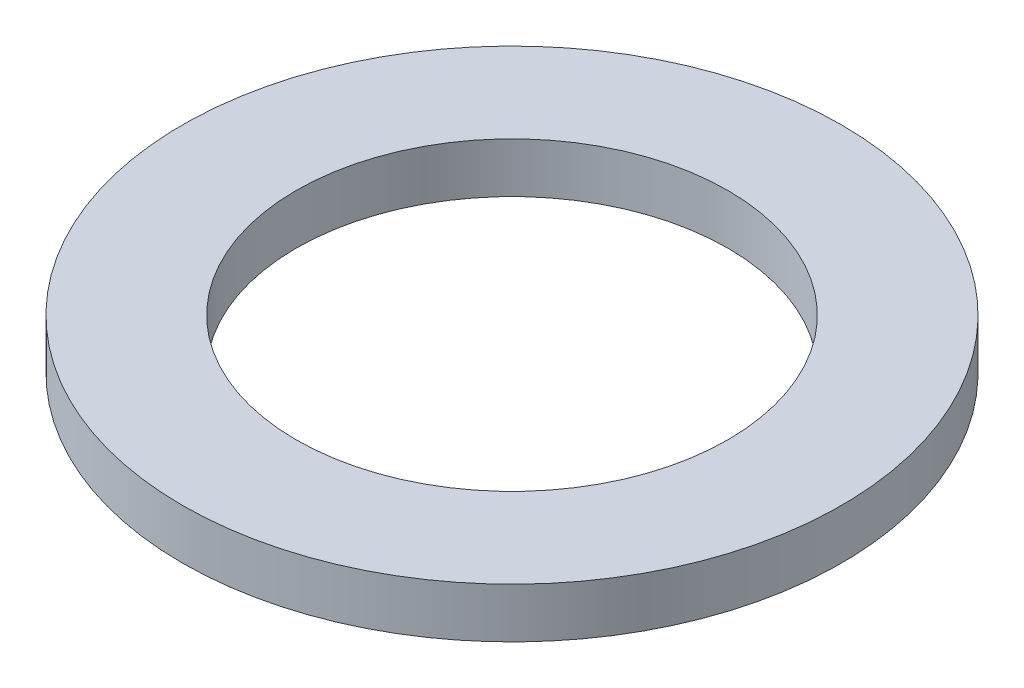
from build123d import *

# Parameters (mm, degrees)
SKETCH1_R           = 72.5
BOSS_EXTRUDE1_DEPTH = 11
SKETCH2_R           = 47.5
CUT_EXTRUDE1_DEPTH  = 104.118863454


with BuildPart() as part:
    # Sketch1 → Boss-Extrude1 (new body)
    with BuildSketch(Plane(origin=(0, 0, 0), x_dir=(1, 0, 0), z_dir=(0, 1, 0))):
        Circle(SKETCH1_R)
    extrude(amount=BOSS_EXTRUDE1_DEPTH)

    # Sketch2 → Cut-Extrude1 (cut, through all)
    with BuildSketch(Plane(origin=(0, 0, 0), x_dir=(1, 0, 0), z_dir=(0, 1, 0))):
        Circle(SKETCH2_R)
    extrude(amount=CUT_EXTRUDE1_DEPTH, mode=Mode.SUBTRACT)


solid = part.part
